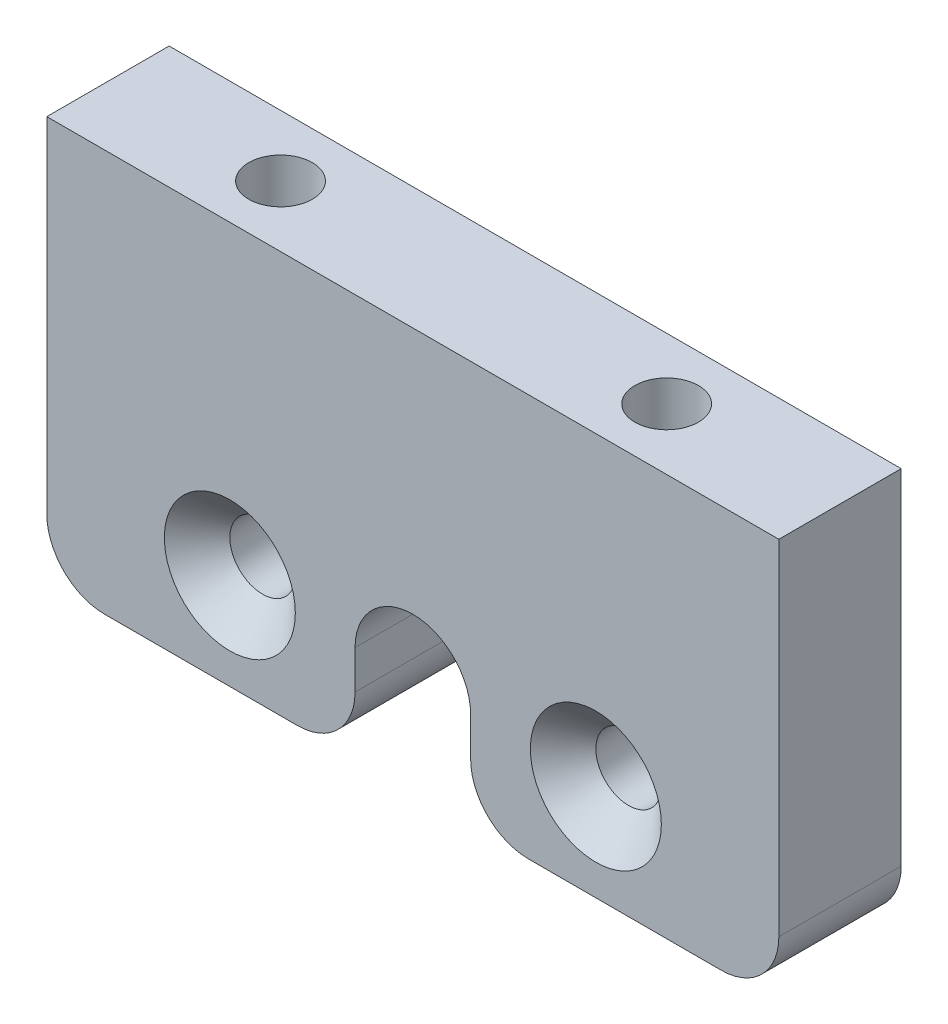
from build123d import *

# Parameters (mm, degrees)
SKETCH1_R           = 1.7
BOSS_EXTRUDE1_DEPTH = 6.35
CHAMFER1_SIZE       = 1.7
SKETCH2_R           = 1.65
CUT_EXTRUDE1_DEPTH  = 10
FILLET1_R           = 3


with BuildPart() as part:
    # Sketch1 → Boss-Extrude1 (new body)
    with BuildSketch(Plane(origin=(7.9e-08, 0, -22.644318005), x_dir=(1.0, 0, 3.501429786466588e-09), z_dir=(-3.501429786466588e-09, 0, 1.0))):
        with BuildLine():
            Line((3.000021754, 6.9987), (3.000021754, 1.9987))
            Line((3.000021754, 1.9987), (19.00000025, 1.9987))
            Line((19.00000025, 1.9987), (19.00000025, 22.8687))
            Line((19.00000025, 22.8687), (-19.00000025, 22.8687))
            Line((-19.00000025, 22.8687), (-19.00000025, 1.9987))
            Line((-19.00000025, 1.9987), (-3.000021754, 1.9987))
            Line((-3.000021754, 1.9987), (-3.000021754, 6.9987))
            ThreePointArc((-3.000021754, 6.9987), (2.5e-07, 9.998721503), (3.000021754, 6.9987))
        make_face()
        with Locations((9.49999975, 6.9987)):
            Circle(SKETCH1_R, mode=Mode.SUBTRACT)
        with Locations((-9.49999975, 6.9987)):
            Circle(SKETCH1_R, mode=Mode.SUBTRACT)
    extrude(amount=BOSS_EXTRUDE1_DEPTH)

    # Chamfer1
    chamfer1_edges = [part.edges().sort_by_distance(p)[0] for p in [
        (-11.199999693, 6.9987, -16.294318044),
        (7.799999807, 6.9987, -16.294317977),
    ]]
    chamfer(chamfer1_edges, length=CHAMFER1_SIZE)

    # Sketch2 → Cut-Extrude1 (cut)
    with BuildSketch(Plane(origin=(0, 22.8687, 0), x_dir=(1, 0, 0), z_dir=(0, 1, 0))):
        with Locations((10, 19.469317938)):
            Circle(SKETCH2_R)
        with Locations((-10.042850258, 19.469317938)):
            Circle(SKETCH2_R)
    extrude(amount=-CUT_EXTRUDE1_DEPTH, mode=Mode.SUBTRACT)

    # Fillet1
    fillet1_edges = [part.edges().sort_by_distance(p)[0] for p in [
        (-19.000000182, 1.9987, -19.469318071),
        (-3.000021685, 1.9987, -19.469318015),
        (3.000021822, 1.9987, -19.469317994),
        (19.000000319, 1.9987, -19.469317938),
    ]]
    fillet(fillet1_edges, radius=FILLET1_R)


solid = part.part
